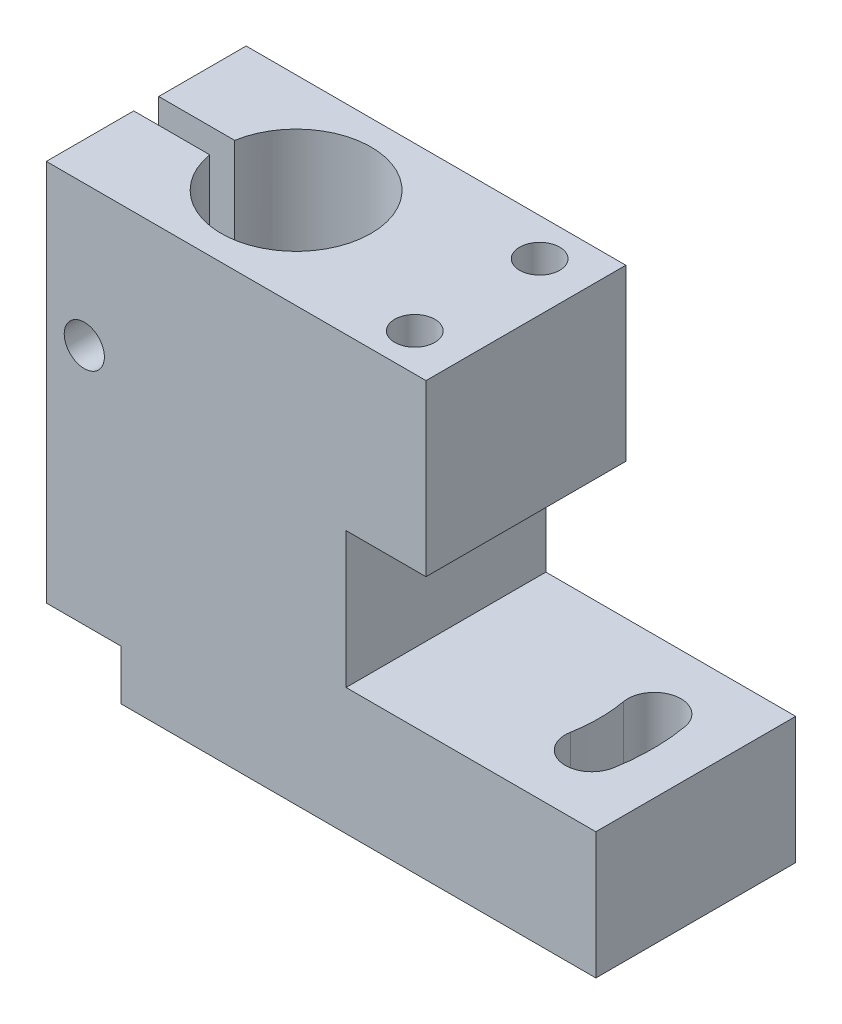
from build123d import *

# Parameters (mm, degrees)
EXTRUDE1_DEPTH              = 12.7
ARC_MOUNTING_SLOT_I_DEPTH   = 56.885195213
CLAMPING_SCREW_HOLES_D      = 5.1054
CLAMPING_SCREW_HOLES_DEPTH  = 21.59
CLAMPING_SCREW_HOLES_TIP    = 1.533816902
SKETCH7_R                   = 9.525
CUT_EXTRUDE1_DEPTH          = 38.862
CUT_EXTRUDE2_DEPTH          = 25.4
ADVANCEDHOLE1_START         = -12.7
ADVANCEDHOLE1_OUTLINE_R     = 2.5527
ADVANCEDHOLE1_DEPTH         = 25.4
ADVANCEDHOLE1_2_OUTLINE_R   = 3.2639
ADVANCEDHOLE1_2_OUTLINE_R_2 = 2.5527
ADVANCEDHOLE1_2_DEPTH       = 11.1125
FILLET1_R                   = 1.5875


# Read off the part's stored shape, not the designer's step: AdvancedHole1
with BuildPart() as part:
    # Sketch1 → Extrude1 (new, symmetric)
    with BuildSketch(Plane.XY):
        Polygon((-28.575, 0), (-28.575, 6.35), (-38.1, 6.35), (-38.1, 16.1036), (-38.1, 54.9656), (-12.7, 54.9656), (10.16, 54.9656), (10.16, 33.3756), (0, 33.3756), (0, 16.1036), (12.7, 16.1036), (31.75, 16.1036), (31.75, 0), align=None)
    extrude(amount=EXTRUDE1_DEPTH, both=True)

    # Sketch2 → Arc mounting slot I (cut, through all)
    with BuildSketch(Plane(origin=(0, 16.1036, 0), x_dir=(-1, 0, 0), z_dir=(0, 1, 0))):
        with BuildLine():
            ThreePointArc((-25.839582785, -4.556215615), (-21.92608696, -7.296474893), (-19.185827683, -3.382979068))
            ThreePointArc((-19.185827683, -3.382979068), (-19.4818, 0), (-19.185827683, 3.382979068))
            ThreePointArc((-19.185827683, 3.382979068), (-21.92608696, 7.296474893), (-25.839582785, 4.556215615))
            ThreePointArc((-25.839582785, 4.556215615), (-26.2382, 0), (-25.839582785, -4.556215615))
        make_face()
    arc_mounting_slot_i = extrude(amount=-ARC_MOUNTING_SLOT_I_DEPTH, mode=Mode.SUBTRACT)

    # Arc mounting slot II: Arc mounting slot I across plane
    add(arc_mounting_slot_i.mirror(Plane(origin=(0, 0, 0), x_dir=(0, 0, 1), z_dir=(1, 0, 0))), mode=Mode.SUBTRACT)

    # Clamping screw holes
    with Locations(Plane(origin=(0, 54.9656, 0), x_dir=(-1, 0, 0), z_dir=(0, 1, 0))):
        with Locations((-3.96875, -7.9375), (-3.96875, 7.9375)):
            Hole(CLAMPING_SCREW_HOLES_D / 2, depth=CLAMPING_SCREW_HOLES_DEPTH)
            with Locations((0, 0, -(CLAMPING_SCREW_HOLES_DEPTH + CLAMPING_SCREW_HOLES_TIP / 2))):  # 118° drill point
                Cone(0, CLAMPING_SCREW_HOLES_D / 2, CLAMPING_SCREW_HOLES_TIP, mode=Mode.SUBTRACT)

    # Sketch7 → Cut-Extrude1 (cut)
    with BuildSketch(Plane(origin=(0, 54.9656, 0), x_dir=(1, 0, 0), z_dir=(0, 1, 0))):
        with Locations(Location((-19.05, 0, 0), (0, 0, 270))):
            Circle(SKETCH7_R)
    extrude(amount=-CUT_EXTRUDE1_DEPTH, mode=Mode.SUBTRACT)

    # Sketch9 → Cut-Extrude2 (cut)
    with BuildSketch(Plane.ZY.offset(38.1)):
        Polygon((-1.5875, 19.2786), (-1.5875, 54.9656), (1.5875, 54.9656), (1.5875, 16.1036), (-12.7, 16.1036), (-12.7, 19.2786), align=None)
    extrude(amount=-CUT_EXTRUDE2_DEPTH, mode=Mode.SUBTRACT)

    # AdvancedHole1 outline → AdvancedHole1 (cut)
    with BuildSketch(Plane.XY.offset(ADVANCEDHOLE1_START)):
        with Locations((-33.270888328, 37.1221)):
            Circle(ADVANCEDHOLE1_OUTLINE_R)
    extrude(amount=ADVANCEDHOLE1_DEPTH, mode=Mode.SUBTRACT)

    # AdvancedHole1 2 outline → AdvancedHole1 2 (cut)
    with BuildSketch(Plane.XY.offset(ADVANCEDHOLE1_START)):
        with Locations((-33.270888328, 37.1221)):
            Circle(ADVANCEDHOLE1_2_OUTLINE_R)
        with Locations((-33.270888328, 37.1221)):
            Circle(ADVANCEDHOLE1_2_OUTLINE_R_2, mode=Mode.SUBTRACT)
    extrude(amount=ADVANCEDHOLE1_2_DEPTH, mode=Mode.SUBTRACT)

    # Fillet1
    fillet1_edges = [part.edges().sort_by_distance(p)[0] for p in [
        (-12.7, 19.2786, -9.899757914),
        (-12.7, 16.1036, -9.899757914),
        (-33.270888328, 16.1036, 1.5875),
    ]]
    fillet(fillet1_edges, radius=FILLET1_R - 0.0001)  # a hair under: the kernel refuses the full size


solid = part.part
